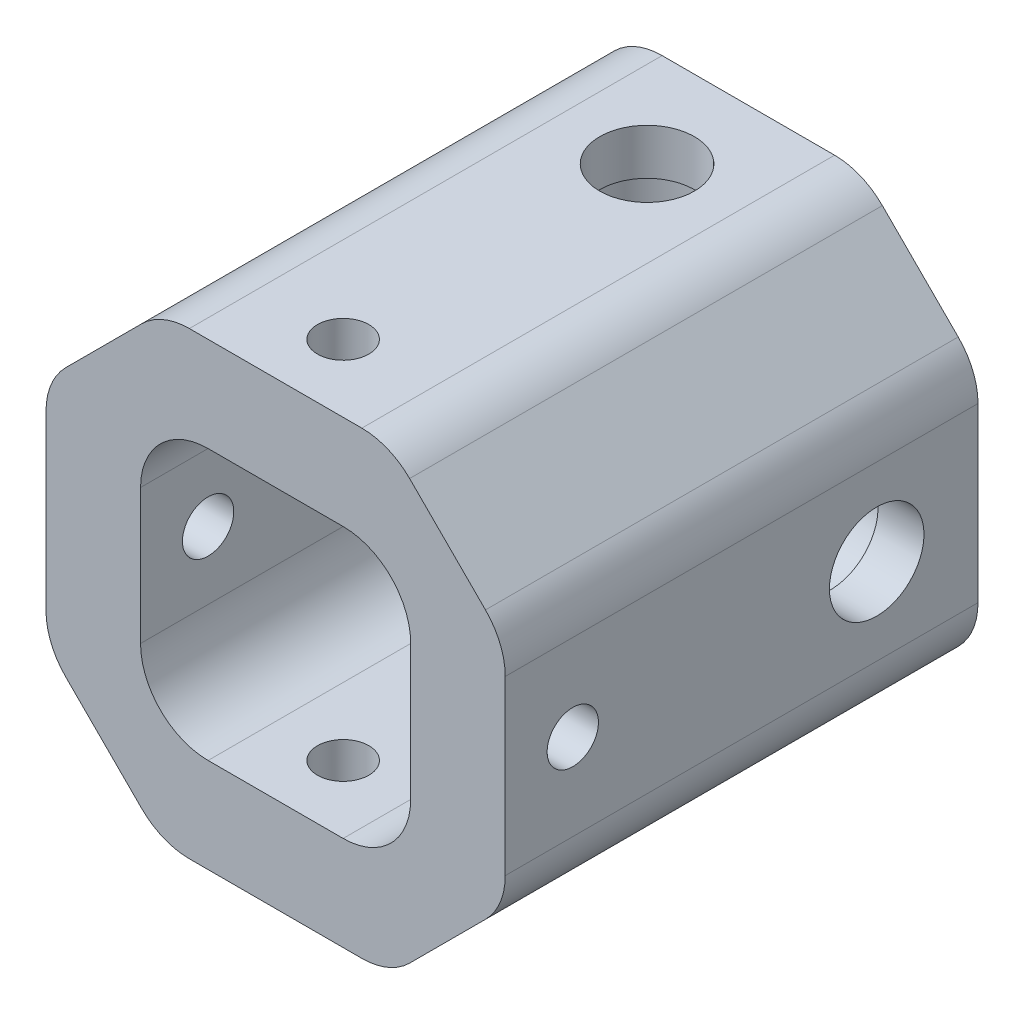
from build123d import *

# Parameters (mm, degrees)
EXTRUDE_1_DEPTH          = 7.5
CUT_EXTRUDE_1_DEPTH      = 30.546573405
CUT_EXTRUDE_1_DEPTH_BACK = 30.546573405
SKETCH_2_W               = 20
SKETCH_2_H               = 20
SKETCH_11_W              = 29.504788154
SKETCH_11_H              = 47.493911142
CUT_EXTRUDE_7_DEPTH      = 1
SKETCH_12_W              = 20.237973212
SKETCH_12_H              = 25.719397838
CUT_EXTRUDE_8_DEPTH      = 1
FILLET_1_R               = 5
FILLET_2_R               = 5
CUT_EXTRUDE_2_DEPTH      = 39.745967532
CUT_EXTRUDE_2_DEPTH_BACK = 39.745967532
SKETCH_3_R               = 4.2
CUT_EXTRUDE_3_DEPTH      = 39.745967532
CUT_EXTRUDE_3_DEPTH_BACK = 39.745967532
SKETCH_4_R               = 4.2
EXTRUDE_2_DEPTH          = 20
SKETCH_6_R               = 4.2
SKETCH_6_R_2             = 3.5
EXTRUDE_3_DEPTH          = 3.4
EXTRUDE_START            = -3.4
SKETCH_13_R              = 4.2
SKETCH_13_R_2            = 3.5
EXTRUDE_4_DEPTH          = 3.4
SKETCH_14_R              = 1.9
CUT_EXTRUDE_9_DEPTH      = 47.917480751
SKETCH_15_R              = 1.9
CUT_EXTRUDE_10_DEPTH     = 47.917480751


with BuildPart() as part:
    # ｽｹｯﾁ1 → ﾎﾞｽ - 押し出し1 (new, symmetric)
    with BuildSketch(Plane.XY):
        Polygon((7.455844123, -18), (18, -7.455844123), (18, 7.455844123), (7.455844123, 18), (-7.455844123, 18), (-18, 7.455844123), (-18, -7.455844123), (-7.455844123, -18), align=None)
    extrude(amount=EXTRUDE_1_DEPTH, both=True)

    # ｽｹｯﾁ2 → ｶｯﾄ - 押し出し1 (cut, two sides: drawn at the far end of the back side and taken through both)
    with BuildSketch(Plane.XY.offset(7.5).offset(-CUT_EXTRUDE_1_DEPTH_BACK)):
        Rectangle(SKETCH_2_W, SKETCH_2_H)
    extrude(amount=CUT_EXTRUDE_1_DEPTH + CUT_EXTRUDE_1_DEPTH_BACK, mode=Mode.SUBTRACT)

    # ｽｹｯﾁ11 → ｶｯﾄ - 押し出し7 (cut)
    with BuildSketch(Plane(origin=(0, 18, 0), x_dir=(1, 0, 0), z_dir=(0, 1, 0))):
        Rectangle(SKETCH_11_W, SKETCH_11_H)
    cut_extrude_7 = extrude(amount=-CUT_EXTRUDE_7_DEPTH, mode=Mode.SUBTRACT)

    # ﾐﾗｰ1: ｶｯﾄ - 押し出し7 across plane
    add(cut_extrude_7.mirror(Plane.ZX), mode=Mode.SUBTRACT)

    # ｽｹｯﾁ12 → ｶｯﾄ - 押し出し8 (cut)
    with BuildSketch(Plane.ZY.offset(18)):
        Rectangle(SKETCH_12_W, SKETCH_12_H)
    cut_extrude_8 = extrude(amount=-CUT_EXTRUDE_8_DEPTH, mode=Mode.SUBTRACT)

    # ﾐﾗｰ2: ｶｯﾄ - 押し出し8 across plane
    add(cut_extrude_8.mirror(Plane(origin=(0, 0, 0), x_dir=(0, 0, 1), z_dir=(1, 0, 0))), mode=Mode.SUBTRACT)

    # ﾌｨﾚｯﾄ1
    fillet_1_edges = [part.edges().sort_by_distance(p)[0] for p in [
        (10, -10, 0),
        (-10, -10, 0),
        (10, 10, 0),
        (-10, 10, 0),
    ]]
    fillet(fillet_1_edges, radius=FILLET_1_R)

    # ﾌｨﾚｯﾄ2
    fillet_2_edges = [part.edges().sort_by_distance(p)[0] for p in [
        (17, -8.455844123, 0),
        (8.455844123, -17, 0),
        (-8.455844123, -17, 0),
        (17, 8.455844123, 0),
        (-17, -8.455844123, 0),
        (-17, 8.455844123, 0),
        (8.455844123, 17, 0),
        (-8.455844123, 17, 0),
    ]]
    fillet(fillet_2_edges, radius=FILLET_2_R)

    # ｽｹｯﾁ3 → ｶｯﾄ - 押し出し2 (cut, two sides: drawn at the far end of the back side and taken through both)
    with BuildSketch(Plane.XZ.offset(17).offset(-CUT_EXTRUDE_2_DEPTH_BACK)):
        Circle(SKETCH_3_R)
    extrude(amount=CUT_EXTRUDE_2_DEPTH + CUT_EXTRUDE_2_DEPTH_BACK, mode=Mode.SUBTRACT)

    # ｽｹｯﾁ4 → ｶｯﾄ - 押し出し3 (cut, two sides: drawn at the far end of the back side and taken through both)
    with BuildSketch(Plane(origin=(17, 0, 0), x_dir=(0, 0, -1), z_dir=(1, 0, 0)).offset(-CUT_EXTRUDE_3_DEPTH_BACK)):
        Circle(SKETCH_4_R)
    extrude(amount=CUT_EXTRUDE_3_DEPTH + CUT_EXTRUDE_3_DEPTH_BACK, mode=Mode.SUBTRACT)

    # ｽｹｯﾁ5 → ﾎﾞｽ - 押し出し2 (add)
    with BuildSketch(Plane.XY.offset(7.5)):
        with BuildLine():
            Line((17, -6.384776311), (17, 6.384776311))
            ThreePointArc((17, 6.384776311), (16.619397663, 8.298193473), (15.535533906, 9.920310217))
            Line((15.535533906, 9.920310217), (9.920310217, 15.535533906))
            ThreePointArc((9.920310217, 15.535533906), (8.298193473, 16.619397663), (6.384776311, 17))
            Line((6.384776311, 17), (-6.384776311, 17))
            ThreePointArc((-6.384776311, 17), (-8.298193473, 16.619397663), (-9.920310217, 15.535533906))
            Line((-9.920310217, 15.535533906), (-15.535533906, 9.920310217))
            ThreePointArc((-15.535533906, 9.920310217), (-16.619397663, 8.298193473), (-17, 6.384776311))
            Line((-17, 6.384776311), (-17, -6.384776311))
            ThreePointArc((-17, -6.384776311), (-16.619397663, -8.298193473), (-15.535533906, -9.920310217))
            Line((-15.535533906, -9.920310217), (-9.920310217, -15.535533906))
            ThreePointArc((-9.920310217, -15.535533906), (-8.298193473, -16.619397663), (-6.384776311, -17))
            Line((-6.384776311, -17), (6.384776311, -17))
            ThreePointArc((6.384776311, -17), (8.298193473, -16.619397663), (9.920310217, -15.535533906))
            Line((9.920310217, -15.535533906), (15.535533906, -9.920310217))
            ThreePointArc((15.535533906, -9.920310217), (16.619397663, -8.298193473), (17, -6.384776311))
        make_face()
        with BuildLine():
            Line((5, 10), (-5, 10))
            ThreePointArc((-5, 10), (-8.535533906, 8.535533906), (-10, 5))
            Line((-10, 5), (-10, -5))
            ThreePointArc((-10, -5), (-8.535533906, -8.535533906), (-5, -10))
            Line((-5, -10), (5, -10))
            ThreePointArc((5, -10), (8.535533906, -8.535533906), (10, -5))
            Line((10, -5), (10, 5))
            ThreePointArc((10, 5), (8.535533906, 8.535533906), (5, 10))
        make_face(mode=Mode.SUBTRACT)
    extrude(amount=EXTRUDE_2_DEPTH)

    # ｽｹｯﾁ6 → ﾎﾞｽ - 押し出し3 (add)
    with BuildSketch(Plane.XZ.offset(17)):
        Circle(SKETCH_6_R)
        Circle(SKETCH_6_R_2, mode=Mode.SUBTRACT)
    extrude_3 = extrude(amount=-EXTRUDE_3_DEPTH)

    # ﾐﾗｰ3: ﾎﾞｽ - 押し出し3 across plane
    add(extrude_3.mirror(Plane.ZX))

    # ｽｹｯﾁ13 → ﾎﾞｽ - 押し出し4 (add)
    with BuildSketch(Plane.ZY.offset(17).offset(EXTRUDE_START)):
        Circle(SKETCH_13_R)
        Circle(SKETCH_13_R_2, mode=Mode.SUBTRACT)
    extrude_4 = extrude(amount=EXTRUDE_4_DEPTH)

    # ﾐﾗｰ4: ﾎﾞｽ - 押し出し4 across plane
    add(extrude_4.mirror(Plane(origin=(0, 0, 0), x_dir=(0, 0, 1), z_dir=(1, 0, 0))))

    # ｽｹｯﾁ14 → ｶｯﾄ - 押し出し9 (cut, through all)
    with BuildSketch(Plane.ZY.offset(17)):
        with Locations((22.5, 0)):
            Circle(SKETCH_14_R)
    extrude(amount=-CUT_EXTRUDE_9_DEPTH, mode=Mode.SUBTRACT)

    # ｽｹｯﾁ15 → ｶｯﾄ - 押し出し10 (cut, through all)
    with BuildSketch(Plane.XZ.offset(17)):
        with Locations((0, 22.5)):
            Circle(SKETCH_15_R)
    extrude(amount=-CUT_EXTRUDE_10_DEPTH, mode=Mode.SUBTRACT)


solid = part.part
